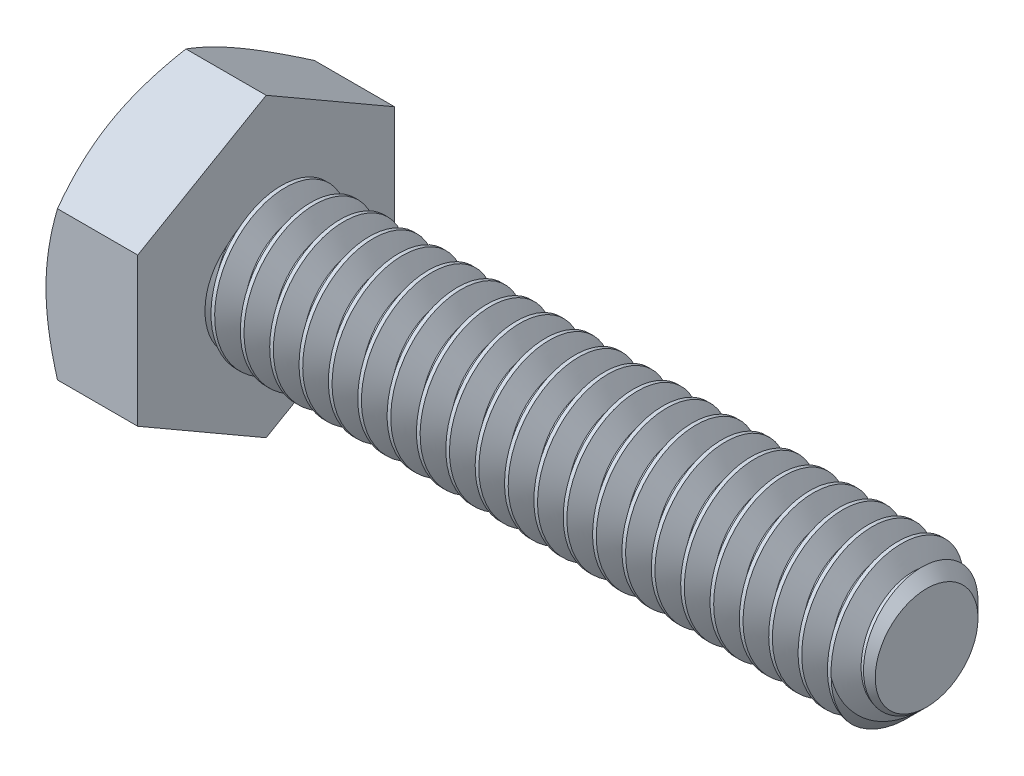
from build123d import *

# Parameters (mm, degrees)
SKETCH5_R           = 3.175
BOSS_EXTRUDE3_DEPTH = 28.575
CHAMFER1_SIZE       = 0.9525
CUT_SWEEP1_PITCH    = 1.27
BOSS_EXTRUDE4_DEPTH = 3.96875
SKETCH8_OUTSIDE_W   = 140.422
SKETCH8_OUTSIDE_H   = 142.142
SKETCH8_OUTSIDE_R   = 5.55625
CUT_EXTRUDE3_DEPTH  = 34.632278233
CUT_EXTRUDE3_DRAFT  = -60


with BuildPart() as part:
    # Sketch5 → Boss-Extrude3 (new body)
    with BuildSketch(Plane(origin=(16.271875, 0, 0), x_dir=(0, 0, -1), z_dir=(1, 0, 0))):
        Circle(SKETCH5_R)
    extrude(amount=-BOSS_EXTRUDE3_DEPTH)

    # Chamfer1
    chamfer1_edges = [part.edges().sort_by_distance(p)[0] for p in [
        (16.271875, 0, 3.175),
    ]]
    chamfer(chamfer1_edges, length=CHAMFER1_SIZE)

    # Cut-Sweep1: the profile of Sketch10 profile screwed along a right-hand helix of 23.5 turns, 8 arcs to a turn; built about Z, then put on its axis
    cut_sweep1_z = Axis((0, 0, 0), (0, 0, 1))
    cut_sweep1_corners = [(3.1753, 0, 0.000173205), (2.350110803, 0, -0.47625), (2.350110803, 0, -0.635), (3.1753, 0, -1.111423205)]
    with BuildLine(mode=Mode.PRIVATE) as cut_sweep1_profile:
        Line(cut_sweep1_corners[0], cut_sweep1_corners[1])
        Line(cut_sweep1_corners[1], cut_sweep1_corners[2])
        Line(cut_sweep1_corners[2], cut_sweep1_corners[3])
        Line(cut_sweep1_corners[3], cut_sweep1_corners[0])
    cut_sweep1_cap = Face(cut_sweep1_profile.wire())
    cut_sweep1_turn_angles = [0, 22.5, 45, 67.5, 90, 112.5, 135, 157.5, 180, 202.5, 225, 247.5, 270, 292.5, 315, 337.5, 360]
    cut_sweep1_turn_weights = [1, 0.9238795325112867, 1, 0.9238795325112867, 1, 0.9238795325112867, 1, 0.9238795325112867, 1, 0.9238795325112867, 1, 0.9238795325112867, 1, 0.9238795325112867, 1, 0.9238795325112867, 1]
    cut_sweep1_turn_rails = [Edge.make_bspline([Vector(p[0], p[1], 0).rotate(cut_sweep1_z, cut_sweep1_turn_angles[k]) / cut_sweep1_turn_weights[k] + Vector(0, 0, p[2] + CUT_SWEEP1_PITCH * cut_sweep1_turn_angles[k] / 360) for k in range(17)], [0, 0, 0, 1, 1, 2, 2, 3, 3, 4, 4, 5, 5, 6, 6, 7, 7, 8, 8, 8], 2, cut_sweep1_turn_weights) for p in cut_sweep1_corners]
    cut_sweep1_turn_sides = [Face.make_surface_from_curves(cut_sweep1_turn_rails[p[0]], cut_sweep1_turn_rails[p[1]]) for p in [(0, 1), (1, 2), (2, 3), (3, 0)]]
    cut_sweep1_last_angles = [8280, 8302.5, 8325, 8347.5, 8370, 8392.5, 8415, 8437.5, 8460]
    cut_sweep1_last_weights = [1, 0.9238795325112867, 1, 0.9238795325112867, 1, 0.9238795325112867, 1, 0.9238795325111105, 1]
    cut_sweep1_last_rails = [Edge.make_bspline([Vector(p[0], p[1], 0).rotate(cut_sweep1_z, cut_sweep1_last_angles[k]) / cut_sweep1_last_weights[k] + Vector(0, 0, p[2] + CUT_SWEEP1_PITCH * cut_sweep1_last_angles[k] / 360) for k in range(9)], [0, 0, 0, 1, 1, 2, 2, 3, 3, 4, 4, 4], 2, cut_sweep1_last_weights) for p in cut_sweep1_corners]
    cut_sweep1_last_sides = [Face.make_surface_from_curves(cut_sweep1_last_rails[p[0]], cut_sweep1_last_rails[p[1]]) for p in [(0, 1), (1, 2), (2, 3), (3, 0)]]
    cut_sweep1 = Plane(origin=(16.271875, 0, 0), x_dir=(0, 1, 0), z_dir=(-1, 0, 0)) * Solid(Shell([*[p.moved(Location((0, 0, CUT_SWEEP1_PITCH * i))) for i in range(23) for p in cut_sweep1_turn_sides], *cut_sweep1_last_sides, cut_sweep1_cap, cut_sweep1_cap.rotate(cut_sweep1_z, 8460).moved(Location((0, 0, CUT_SWEEP1_PITCH * 8460 / 360)))]))
    add(cut_sweep1, mode=Mode.SUBTRACT)

    # Sketch6 → Boss-Extrude4 (add)
    with BuildSketch(Plane.ZY.offset(12.303125)):
        Polygon((5.55625, 3.207902433), (0, 6.415804866), (-5.55625, 3.207902433), (-5.55625, -3.207902433), (0, -6.415804866), (5.55625, -3.207902433), align=None)
    extrude(amount=BOSS_EXTRUDE4_DEPTH)


with BuildPart() as cut_extrude3_tool:
    # Sketch8 outside → Cut-Extrude3 (with draft: the straight prism first)
    with BuildSketch(Plane.ZY.offset(16.271875)):
        Rectangle(SKETCH8_OUTSIDE_W, SKETCH8_OUTSIDE_H)
        Circle(SKETCH8_OUTSIDE_R, mode=Mode.SUBTRACT)
    extrude(amount=-CUT_EXTRUDE3_DEPTH)
    # Cut-Extrude3: the draft: its side faces are tilted about the plane it starts from
    cut_extrude3_sides = [cut_extrude3_tool.faces().sort_by_distance(p)[0] for p in [
        (1.044264116, -71.071, 0),
        (1.044264116, 0, 70.211),
        (1.044264116, 71.071, 0),
        (1.044264116, 0, -70.211),
        (1.044264116, 0, -5.55625),
    ]]
    draft(cut_extrude3_sides, Plane.ZY.offset(16.271875), CUT_EXTRUDE3_DRAFT)


with BuildPart() as part_1:
    add(part.part)

    # Cut-Extrude3: cut by cut_extrude3_tool
    add(cut_extrude3_tool.part, mode=Mode.SUBTRACT)


solid = part_1.part
